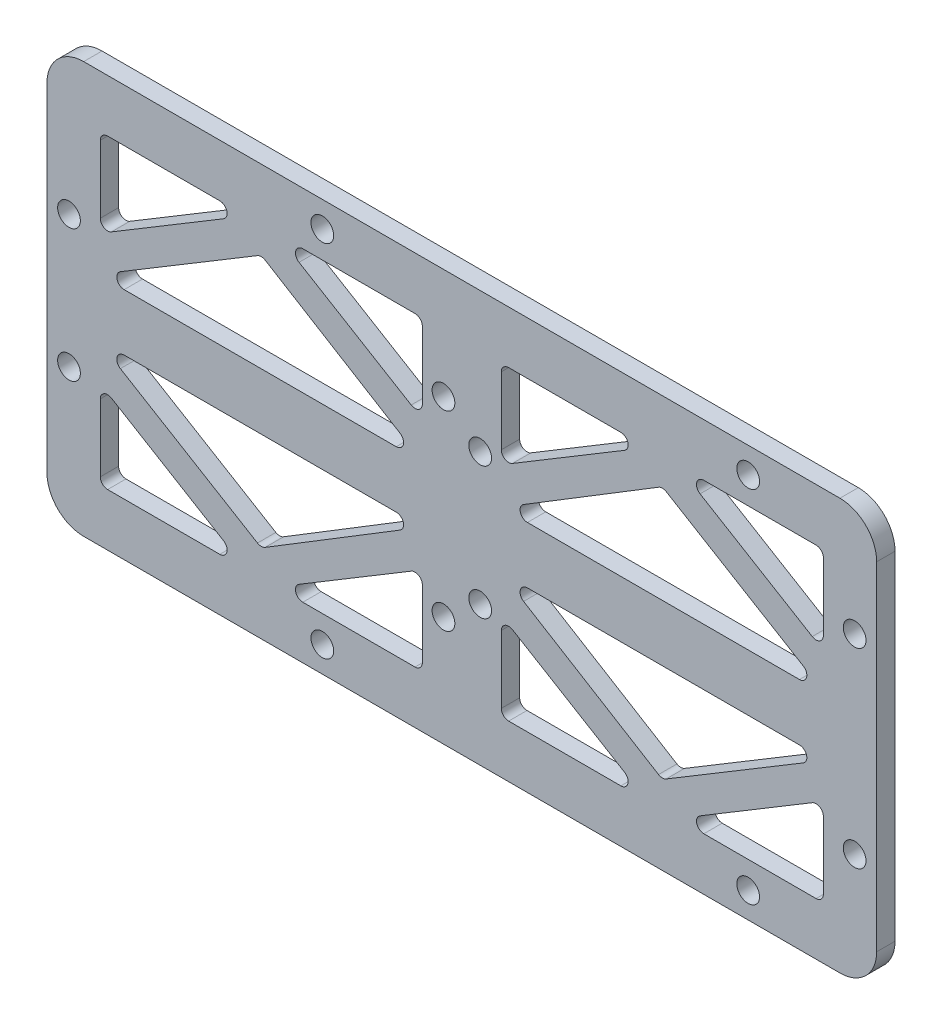
from build123d import *

# Parameters (mm, degrees)
SKETCH_1_2_R    = 1.55
EXTRUDE_2_DEPTH = 2.5


with BuildPart() as part:
    # 草图1<2> → 凸台-拉伸2 (new body)
    with BuildSketch(Plane.XY):
        with BuildLine():
            Line((-51.5, -28), (51.5, -28))
            ThreePointArc((51.5, -28), (55.035533906, -26.535533906), (56.5, -23))
            Line((56.5, -23), (56.5, 23))
            ThreePointArc((56.5, 23), (55.035533906, 26.535533906), (51.5, 28))
            Line((51.5, 28), (-51.5, 28))
            ThreePointArc((-51.5, 28), (-55.035533906, 26.535533906), (-56.5, 23))
            Line((-56.5, 23), (-56.5, -23))
            ThreePointArc((-56.5, -23), (-55.035533906, -26.535533906), (-51.5, -28))
        make_face()
        with Locations((-53.5, 9)):
            Circle(SKETCH_1_2_R, mode=Mode.SUBTRACT)
        with Locations((-53.5, -9)):
            Circle(SKETCH_1_2_R, mode=Mode.SUBTRACT)
        with Locations((53.5, 13)):
            Circle(SKETCH_1_2_R, mode=Mode.SUBTRACT)
        with Locations((53.5, -13)):
            Circle(SKETCH_1_2_R, mode=Mode.SUBTRACT)
        with Locations((39, -24.5)):
            Circle(SKETCH_1_2_R, mode=Mode.SUBTRACT)
        with Locations((39, 24.5)):
            Circle(SKETCH_1_2_R, mode=Mode.SUBTRACT)
        with Locations((-19, 24.5)):
            Circle(SKETCH_1_2_R, mode=Mode.SUBTRACT)
        with Locations((-19, -24.5)):
            Circle(SKETCH_1_2_R, mode=Mode.SUBTRACT)
        with Locations((2.5, -9)):
            Circle(SKETCH_1_2_R, mode=Mode.SUBTRACT)
        with Locations((2.5, 9)):
            Circle(SKETCH_1_2_R, mode=Mode.SUBTRACT)
        with Locations((-2.5, -13)):
            Circle(SKETCH_1_2_R, mode=Mode.SUBTRACT)
        with Locations((-2.5, 13)):
            Circle(SKETCH_1_2_R, mode=Mode.SUBTRACT)
        with BuildLine():
            Line((-45.989475194, -3.858630901), (-8.932171108, -3.858630901))
            ThreePointArc((-8.932171108, -3.858630901), (-7.969544574, -4.587798563), (-8.410750319, -5.711930591))
            Line((-8.410750319, -5.711930591), (-26.792670427, -16.944461679))
            ThreePointArc((-26.792670427, -16.944461679), (-27.310580494, -17.091155827), (-27.829507794, -16.948101749))
            Line((-27.829507794, -16.948101749), (-46.504891772, -5.715570661))
            ThreePointArc((-46.504891772, -5.715570661), (-46.953046614, -4.591179746), (-45.989475194, -3.858630901))
        make_face(mode=Mode.SUBTRACT)
        with BuildLine():
            Line((-47.726710157, -9.799051859), (-32.445899276, -18.989876716))
            ThreePointArc((-32.445899276, -18.989876716), (-31.997744434, -20.114267631), (-32.961315853, -20.846816476))
            Line((-32.961315853, -20.846816476), (-48.242126734, -20.846816476))
            ThreePointArc((-48.242126734, -20.846816476), (-48.949233515, -20.553923257), (-49.242126734, -19.846816476))
            Line((-49.242126734, -19.846816476), (-49.242126734, -10.655991619))
            ThreePointArc((-49.242126734, -10.655991619), (-48.734358094, -9.785527209), (-47.726710157, -9.799051859))
        make_face(mode=Mode.SUBTRACT)
        with BuildLine():
            Line((-5.377844684, -10.655991619), (-5.377844684, -19.846816476))
            ThreePointArc((-5.377844684, -19.846816476), (-5.670737903, -20.553923257), (-6.377844684, -20.846816476))
            Line((-6.377844684, -20.846816476), (-21.658655565, -20.846816476))
            ThreePointArc((-21.658655565, -20.846816476), (-22.622226984, -20.114267631), (-22.174072143, -18.989876716))
            Line((-22.174072143, -18.989876716), (-6.893261261, -9.799051859))
            ThreePointArc((-6.893261261, -9.799051859), (-5.885613324, -9.785527209), (-5.377844684, -10.655991619))
        make_face(mode=Mode.SUBTRACT)
        with BuildLine():
            Line((-6.893261261, 9.799051859), (-22.174072143, 18.989876716))
            ThreePointArc((-22.174072143, 18.989876716), (-22.622226984, 20.114267631), (-21.658655565, 20.846816476))
            Line((-21.658655565, 20.846816476), (-6.377844684, 20.846816476))
            ThreePointArc((-6.377844684, 20.846816476), (-5.670737903, 20.553923257), (-5.377844684, 19.846816476))
            Line((-5.377844684, 19.846816476), (-5.377844684, 10.655991619))
            ThreePointArc((-5.377844684, 10.655991619), (-5.885613324, 9.785527209), (-6.893261261, 9.799051859))
        make_face(mode=Mode.SUBTRACT)
        with BuildLine():
            Line((-49.242126734, 10.655991619), (-49.242126734, 19.846816476))
            ThreePointArc((-49.242126734, 19.846816476), (-48.949233515, 20.553923257), (-48.242126734, 20.846816476))
            Line((-48.242126734, 20.846816476), (-32.961315853, 20.846816476))
            ThreePointArc((-32.961315853, 20.846816476), (-31.997744434, 20.114267631), (-32.445899276, 18.989876716))
            Line((-32.445899276, 18.989876716), (-47.726710157, 9.799051859))
            ThreePointArc((-47.726710157, 9.799051859), (-48.734358094, 9.785527209), (-49.242126734, 10.655991619))
        make_face(mode=Mode.SUBTRACT)
        with BuildLine():
            Line((-8.410750319, 5.711930591), (-26.792670427, 16.944461679))
            ThreePointArc((-26.792670427, 16.944461679), (-27.310580494, 17.091155827), (-27.829507794, 16.948101749))
            Line((-27.829507794, 16.948101749), (-46.504891772, 5.715570661))
            ThreePointArc((-46.504891772, 5.715570661), (-46.953046614, 4.591179746), (-45.989475194, 3.858630901))
            Line((-45.989475194, 3.858630901), (-8.932171108, 3.858630901))
            ThreePointArc((-8.932171108, 3.858630901), (-7.969544574, 4.587798563), (-8.410750319, 5.711930591))
        make_face(mode=Mode.SUBTRACT)
        with BuildLine():
            Line((5.377844684, 10.655991619), (5.377844684, 19.846816476))
            ThreePointArc((5.377844684, 19.846816476), (5.670737903, 20.553923257), (6.377844684, 20.846816476))
            Line((6.377844684, 20.846816476), (21.658655565, 20.846816476))
            ThreePointArc((21.658655565, 20.846816476), (22.622226984, 20.114267631), (22.174072143, 18.989876716))
            Line((22.174072143, 18.989876716), (6.893261261, 9.799051859))
            ThreePointArc((6.893261261, 9.799051859), (5.885613324, 9.785527209), (5.377844684, 10.655991619))
        make_face(mode=Mode.SUBTRACT)
        with BuildLine():
            Line((47.726710157, 9.799051859), (32.445899276, 18.989876716))
            ThreePointArc((32.445899276, 18.989876716), (31.997744434, 20.114267631), (32.961315853, 20.846816476))
            Line((32.961315853, 20.846816476), (48.242126734, 20.846816476))
            ThreePointArc((48.242126734, 20.846816476), (48.949233515, 20.553923257), (49.242126734, 19.846816476))
            Line((49.242126734, 19.846816476), (49.242126734, 10.655991619))
            ThreePointArc((49.242126734, 10.655991619), (48.734358094, 9.785527209), (47.726710157, 9.799051859))
        make_face(mode=Mode.SUBTRACT)
        with BuildLine():
            Line((45.989475194, 3.858630901), (8.932171108, 3.858630901))
            ThreePointArc((8.932171108, 3.858630901), (7.969544574, 4.587798563), (8.410750319, 5.711930591))
            Line((8.410750319, 5.711930591), (26.792670427, 16.944461679))
            ThreePointArc((26.792670427, 16.944461679), (27.310580494, 17.091155827), (27.829507794, 16.948101749))
            Line((27.829507794, 16.948101749), (46.504891772, 5.715570661))
            ThreePointArc((46.504891772, 5.715570661), (46.953046614, 4.591179746), (45.989475194, 3.858630901))
        make_face(mode=Mode.SUBTRACT)
        with BuildLine():
            Line((47.726710157, -9.799051859), (32.445899276, -18.989876716))
            ThreePointArc((32.445899276, -18.989876716), (31.997744434, -20.114267631), (32.961315853, -20.846816476))
            Line((32.961315853, -20.846816476), (48.242126734, -20.846816476))
            ThreePointArc((48.242126734, -20.846816476), (48.949233515, -20.553923257), (49.242126734, -19.846816476))
            Line((49.242126734, -19.846816476), (49.242126734, -10.655991619))
            ThreePointArc((49.242126734, -10.655991619), (48.734358094, -9.785527209), (47.726710157, -9.799051859))
        make_face(mode=Mode.SUBTRACT)
        with BuildLine():
            Line((5.377844684, -10.655991619), (5.377844684, -19.846816476))
            ThreePointArc((5.377844684, -19.846816476), (5.670737903, -20.553923257), (6.377844684, -20.846816476))
            Line((6.377844684, -20.846816476), (21.658655565, -20.846816476))
            ThreePointArc((21.658655565, -20.846816476), (22.622226984, -20.114267631), (22.174072143, -18.989876716))
            Line((22.174072143, -18.989876716), (6.893261261, -9.799051859))
            ThreePointArc((6.893261261, -9.799051859), (5.885613324, -9.785527209), (5.377844684, -10.655991619))
        make_face(mode=Mode.SUBTRACT)
        with BuildLine():
            Line((45.989475194, -3.858630901), (8.932171108, -3.858630901))
            ThreePointArc((8.932171108, -3.858630901), (7.969544574, -4.587798563), (8.410750319, -5.711930591))
            Line((8.410750319, -5.711930591), (26.792670427, -16.944461679))
            ThreePointArc((26.792670427, -16.944461679), (27.310580494, -17.091155827), (27.829507794, -16.948101749))
            Line((27.829507794, -16.948101749), (46.504891772, -5.715570661))
            ThreePointArc((46.504891772, -5.715570661), (46.953046614, -4.591179746), (45.989475194, -3.858630901))
        make_face(mode=Mode.SUBTRACT)
    extrude(amount=EXTRUDE_2_DEPTH)


solid = part.part
